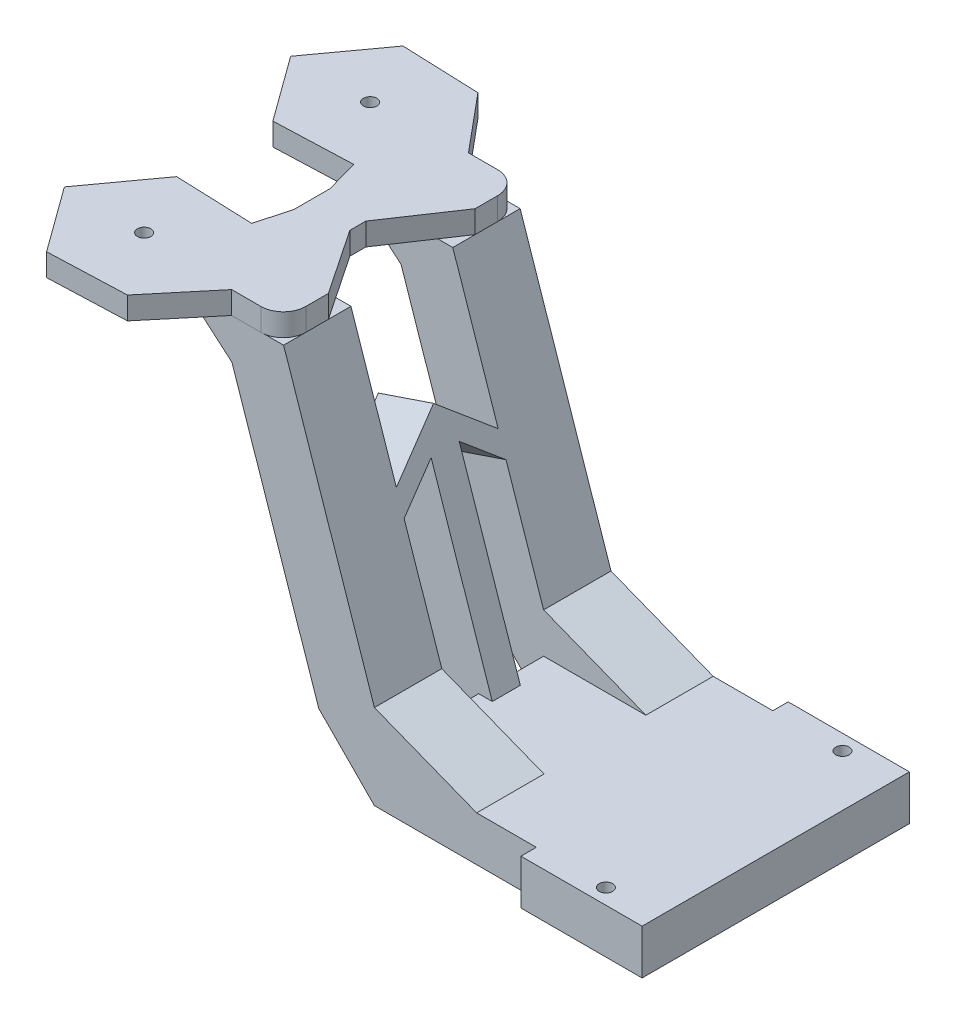
from build123d import *

# Parameters (mm, degrees)
CROQUIS1_R              = 1.5
SALIENTE_EXTRUIR1_DEPTH = 10
SALIENTE_EXTRUIR2_DEPTH = 15
MATRIZL1_COUNT          = 2
MATRIZL1_PITCH          = 37.68964915
SALIENTE_EXTRUIR3_DEPTH = 13
SALIENTE_EXTRUIR7_DEPTH = 5
REDONDEO2_R             = 10
CROQUIS11_R             = 1.5
CORTAR_EXTRUIR2_DEPTH   = 5


with BuildPart() as part:
    # Croquis1 → Saliente-Extruir1 (new body)
    with BuildSketch(Plane(origin=(0, 0, 0), x_dir=(1, 0, 0), z_dir=(0, 1, 0))):
        Polygon((-189.195504205, 26.344824576), (-153.149960772, 26.344824576), (-153.149960772, 29.769862991), (-126.147833027, 29.769862991), (-126.147833027, -29.769862991), (-153.149960772, -29.769862991), (-153.149960772, -26.344824576), (-189.195504205, -26.344824576), align=None)
        with Locations(Location((-137.631197841, 26.344824576, 0), (0, 0, 270))):
            Circle(CROQUIS1_R, mode=Mode.SUBTRACT)
        with Locations(Location((-137.631197841, -26.344824576, 0), (0, 0, 90))):
            Circle(CROQUIS1_R, mode=Mode.SUBTRACT)
    extrude(amount=SALIENTE_EXTRUIR1_DEPTH)

    # Croquis3 → Saliente-Extruir2 (add)
    with BuildSketch(Plane.XY.offset(26.344824576)):
        Polygon((-189.195504205, 0), (-201.604805992, 12.545329197), (-220.943628409, 69.680078214), (-231.495067756, 78.724169083), (-209.43357333, 78.724169083), (-189.195504205, 18.932679451), (-166.427858451, 10), (-166.427858451, 0), align=None)
    saliente_extruir2 = extrude(amount=-SALIENTE_EXTRUIR2_DEPTH)

    # MatrizL1: Saliente-Extruir2 ×2
    with Locations(*[(0, 0, -i * MATRIZL1_PITCH) for i in range(1, MATRIZL1_COUNT)]):
        add(saliente_extruir2)

    # Croquis8 → Saliente-Extruir3 (add)
    with BuildSketch(Plane(origin=(-163.998418841, -55.509761627, 0), x_dir=(0, 0, -1), z_dir=(0.9472114013741786, 0.3206096709501519, 0))):
        Polygon((-11.344824576, 110.153008866), (-11.344824576, 104.748047896), (-3.12328674, 111.657611587), (-3.12328674, 63.690909236), (3.123286737, 63.690909236), (3.123286737, 111.657611587), (11.344824574, 104.748047896), (11.344824574, 110.153008866), (-1e-09, 119.687452364), align=None)
    extrude(amount=-SALIENTE_EXTRUIR3_DEPTH)

    # Croquis10 → Saliente-Extruir7 (add)
    with BuildSketch(Plane(origin=(0, 78.724169083, 0), x_dir=(1, 0, 0), z_dir=(0, 1, 0))):
        with BuildLine():
            Line((-214.43357333, 26.344824574), (-220.943628409, 26.344824574))
            Line((-220.943628409, 26.344824574), (-231.495067756, 39.001543724))
            Line((-231.495067756, 39.001543724), (-248.853619127, 39.65983126))
            Line((-248.853619127, 39.65983126), (-259.380857056, 25.173184149))
            Line((-259.380857056, 25.173184149), (-248.853619127, 10.686537038))
            Line((-248.853619127, 10.686537038), (-231.495067756, 11.344824574))
            Line((-231.495067756, 11.344824574), (-229.458019065, 3.999750012))
            Line((-229.458019065, 3.999750012), (-229.458019065, -4.057622202))
            Line((-229.458019065, -4.057622202), (-231.495067756, -11.402696763))
            Line((-231.495067756, -11.402696763), (-248.853619127, -10.744409227))
            Line((-248.853619127, -10.744409227), (-259.380857056, -25.231056338))
            Line((-259.380857056, -25.231056338), (-248.853619127, -39.71770345))
            Line((-248.853619127, -39.71770345), (-231.495067756, -39.059415914))
            Line((-231.495067756, -39.059415914), (-220.943628409, -26.402696763))
            Line((-220.943628409, -26.402696763), (-214.43357333, -26.402696763))
            ThreePointArc((-214.43357333, -26.402696763), (-210.898039424, -24.938230669), (-209.43357333, -21.402696763))
            Line((-209.43357333, -21.402696763), (-209.43357333, -16.36524325))
            Line((-209.43357333, -16.36524325), (-219.208523363, -1.818697081))
            Line((-219.208523363, -1.818697081), (-219.208523363, 1.760824892))
            Line((-219.208523363, 1.760824892), (-209.43357333, 16.30737106))
            Line((-209.43357333, 16.30737106), (-209.43357333, 21.344824574))
            ThreePointArc((-209.43357333, 21.344824574), (-210.898039424, 24.880358479), (-214.43357333, 26.344824574))
        make_face()
    extrude(amount=SALIENTE_EXTRUIR7_DEPTH)

    # Redondeo2
    # the kernel refuses this fillet: 10 mm, written as the material it takes off along each edge
    with BuildSketch(Plane(origin=(-196.732088511, 0.651068043, 27.595787298), x_dir=(-0.3206096709501526, 0.9472114013741784, 0), z_dir=(0, 0, -1))) as redondeo2_piece_1_section:
        with BuildLine():
            CenterArc((9.789000223, 10), REDONDEO2_R, 191.790853222, 78.209146778)
            Line((0, 7.956602185), (0, 0))
            Line((0, 0), (9.789000223, 0))
        make_face()
    redondeo2_piece_1 = extrude(amount=30.719074034, mode=Mode.PRIVATE)
    redondeo2_piece_1 = split(redondeo2_piece_1, bisect_by=Plane(origin=(-197.071889221, 5.655111801, 11.344824576), z_dir=(0, 0, -1)), keep=Keep.TOP, mode=Mode.PRIVATE)
    add(redondeo2_piece_1, mode=Mode.SUBTRACT)

    # Croquis11 → Cortar-Extruir2 (cut)
    with BuildSketch(Plane(origin=(0, 83.724169083, 0), x_dir=(1, 0, 0), z_dir=(0, 1, 0))):
        with Locations(Location((-241.678058983, 25.173184149, 0), (0, 0, 270))):
            Circle(CROQUIS11_R)
        with Locations(Location((-241.678058983, -25.173184149, 0), (0, 0, 90))):
            Circle(CROQUIS11_R)
    extrude(amount=-CORTAR_EXTRUIR2_DEPTH, mode=Mode.SUBTRACT)


solid = part.part
